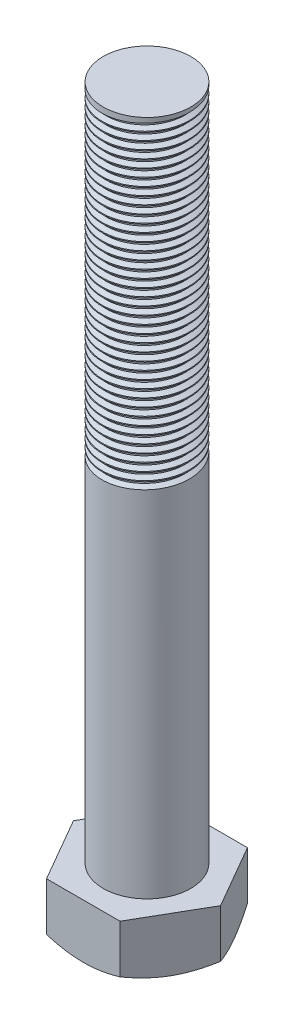
from build123d import *

# Parameters (mm, degrees)
SKETCH1_R           = 11
BOSS_EXTRUDE1_DEPTH = 170
THREAD1_PITCH       = 2
BOSS_EXTRUDE2_DEPTH = 14


with BuildPart() as part:
    # Sketch1 → Boss-Extrude1 (new body)
    with BuildSketch(Plane(origin=(0, 0, 0), x_dir=(1, 0, 0), z_dir=(0, 1, 0))):
        with Locations(Location((0, 0, 0), (0, 0, 270))):
            Circle(SKETCH1_R)
    extrude(amount=BOSS_EXTRUDE1_DEPTH)

    # Thread1: the profile of Thread Profile1 profile screwed along a right-hand helix of 40 turns, 10 arcs to a turn; built about Z, then put on its axis
    thread1_z = Axis((0, 0, 0), (0, 0, 1))
    thread1_corners = [(11.0003, 0, -0.000173205), (11.0003, 0, 1.7501732), (9.91746825, 0, 1.124999997), (9.91746825, 0, 0.624999997)]
    with BuildLine(mode=Mode.PRIVATE) as thread1_profile:
        Line(thread1_corners[0], thread1_corners[1])
        Line(thread1_corners[1], thread1_corners[2])
        Line(thread1_corners[2], thread1_corners[3])
        Line(thread1_corners[3], thread1_corners[0])
    thread1_cap = Face(thread1_profile.wire())
    thread1_turn_angles = [0, 18, 36, 54, 72, 90, 108, 126, 144, 162, 180, 198, 216, 234, 252, 270, 288, 306, 324, 342, 360, 378, 396, 414, 432, 450, 468, 486, 504, 522, 540, 558, 576, 594, 612, 630, 648, 666, 684, 702, 720]
    thread1_turn_weights = [1, 0.9510565162951535, 1, 0.9510565162951535, 1, 0.9510565162951535, 1, 0.9510565162951535, 1, 0.9510565162951535, 1, 0.9510565162951535, 1, 0.9510565162951535, 1, 0.9510565162951535, 1, 0.9510565162951535, 1, 0.9510565162951535, 1, 0.9510565162951535, 1, 0.9510565162951535, 1, 0.9510565162951535, 1, 0.9510565162951535, 1, 0.9510565162951535, 1, 0.9510565162951535, 1, 0.9510565162951535, 1, 0.9510565162951535, 1, 0.9510565162951535, 1, 0.9510565162951535, 1]
    thread1_turn_rails = [Edge.make_bspline([Vector(p[0], p[1], 0).rotate(thread1_z, thread1_turn_angles[k]) / thread1_turn_weights[k] + Vector(0, 0, p[2] + THREAD1_PITCH * thread1_turn_angles[k] / 360) for k in range(41)], [0, 0, 0, 1, 1, 2, 2, 3, 3, 4, 4, 5, 5, 6, 6, 7, 7, 8, 8, 9, 9, 10, 10, 11, 11, 12, 12, 13, 13, 14, 14, 15, 15, 16, 16, 17, 17, 18, 18, 19, 19, 20, 20, 20], 2, thread1_turn_weights) for p in thread1_corners]
    thread1_turn_sides = [Face.make_surface_from_curves(thread1_turn_rails[p[0]], thread1_turn_rails[p[1]]) for p in [(0, 1), (1, 2), (2, 3), (3, 0)]]
    thread1 = Plane(origin=(0, 170, 0), x_dir=(-1, 0, 0), z_dir=(0, -1, 0)) * Solid(Shell([*[p.moved(Location((0, 0, 2 * THREAD1_PITCH * i))) for i in range(20) for p in thread1_turn_sides], thread1_cap, thread1_cap.rotate(thread1_z, 14400).moved(Location((0, 0, THREAD1_PITCH * 14400 / 360)))]))
    add(thread1, mode=Mode.SUBTRACT)

    # Sketch6 → Boss-Extrude2 (add)
    with BuildSketch(Plane(origin=(0, 0, 0), x_dir=(1, 0, 0), z_dir=(0, 1, 0))):
        Polygon((18.475208614, 0), (9.237604307, 16), (-9.237604307, 16), (-18.475208614, 0), (-9.237604307, -16), (9.237604307, -16), align=None)
    extrude(amount=-BOSS_EXTRUDE2_DEPTH)

    # Sketch7 → Cut-Revolve1 (revolve, cut)
    with BuildSketch(Plane.XY):
        Polygon((-19.422339883, -11.576831556), (-13.521223572, -15.027484314), (-19.422339883, -15.027484314), align=None)
    revolve(axis=Axis((0, -8.107713708, 0), (0, -1, 0)), mode=Mode.SUBTRACT)


solid = part.part
